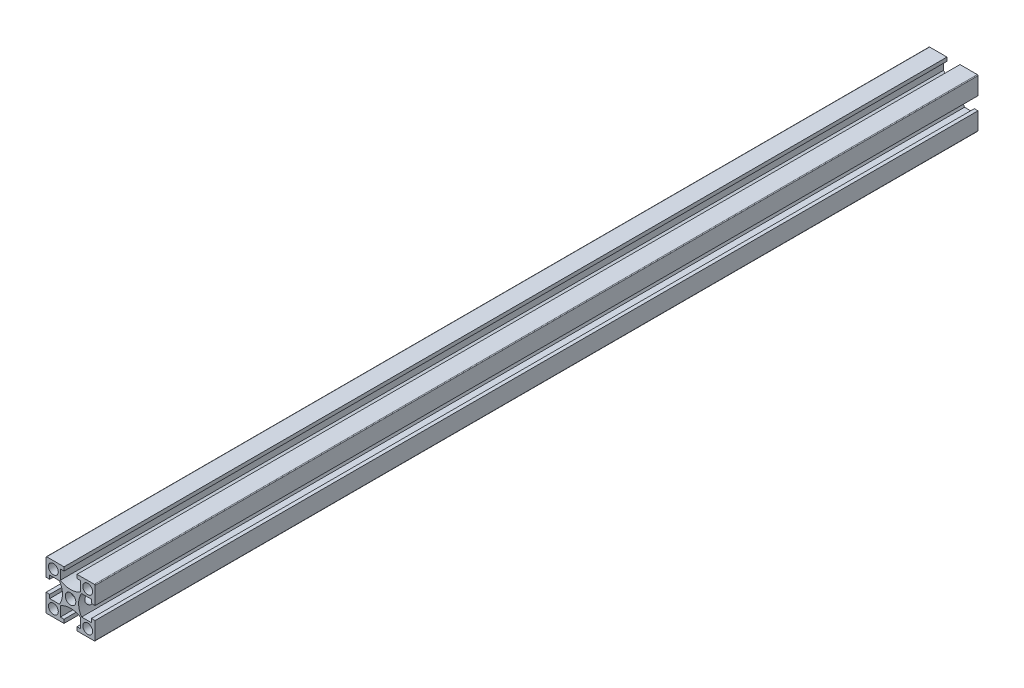
from build123d import *

# Parameters (mm, degrees)
SKETCH_1_W               = 20
SKETCH_1_H               = 20
SKETCH_1_R               = 2
SKETCH_1_R_2             = 2.15
EXTRUDE_1_DEPTH          = 360
CUT_EXTRUDE_1_REACH      = 362.278
PATTERN_CIRCULAR_1_COUNT = 4
FILLET_1_R               = 0.3
CUT_EXTRUDE_2_DEPTH      = 361.277670693
CUT_EXTRUDE_2_DEPTH_BACK = 361.277670693
SKETCH_2_R               = 2.5


with BuildPart() as part:
    # 스케치1 → 보스-돌출1 (new body)
    with BuildSketch(Plane.XY):
        Rectangle(SKETCH_1_W, SKETCH_1_H)
        with Locations((-7, -7)):
            Circle(SKETCH_1_R, mode=Mode.SUBTRACT)
        with Locations((7, -7)):
            Circle(SKETCH_1_R, mode=Mode.SUBTRACT)
        with Locations((-7, 7)):
            Circle(SKETCH_1_R, mode=Mode.SUBTRACT)
        Circle(SKETCH_1_R_2, mode=Mode.SUBTRACT)
        with Locations((7, 7)):
            Circle(SKETCH_1_R, mode=Mode.SUBTRACT)
    extrude(amount=EXTRUDE_1_DEPTH)

    # 스케치1<3> → 컷-돌출1 (cut, up to next)
    with BuildSketch(Plane.XY, mode=Mode.PRIVATE) as cut_extrude_1_sk1:
        with BuildLine():
            Line((-8.5, 2.65), (-10, 2.65))
            Line((-10, 2.65), (-10, -2.65))
            Line((-10, -2.65), (-8.5, -2.65))
            Line((-8.5, -2.65), (-8.5, -4.15))
            Line((-8.5, -4.15), (-4.503166667, -4.15))
            ThreePointArc((-4.503166667, -4.15), (-3.3, 0), (-4.503166667, 4.15))
            Line((-4.503166667, 4.15), (-8.5, 4.15))
            Line((-8.5, 4.15), (-8.5, 2.65))
        make_face()
    cut_extrude_1_tool1 = extrude(cut_extrude_1_sk1.sketch, amount=CUT_EXTRUDE_1_REACH, mode=Mode.PRIVATE) & part.part
    cut_extrude_1 = cut_extrude_1_tool1.solids().sort_by_distance((-6.606913, 0, 0))[0]
    add(cut_extrude_1, mode=Mode.SUBTRACT)

    # 원형 패턴1: 컷-돌출1 ×4 about axis
    pattern_circular_1_axis = Axis((0, 0, 360), (0, 0, -1))
    for i in range(1, PATTERN_CIRCULAR_1_COUNT):
        add(cut_extrude_1.rotate(pattern_circular_1_axis, i * 360 / PATTERN_CIRCULAR_1_COUNT), mode=Mode.SUBTRACT)

    # 필렛1
    fillet_1_edges = [part.edges().sort_by_distance(p)[0] for p in [
        (10, -10, 180),
        (-10, -10, 180),
        (-10, 10, 180),
        (10, 10, 180),
    ]]
    fillet(fillet_1_edges, radius=FILLET_1_R)

    # 스케치2 → 컷-돌출2 (cut, two sides: drawn at the far end of the back side and taken through both)
    with BuildSketch(Plane(origin=(0, 0, 0), x_dir=(0, 0, -1), z_dir=(1, 0, 0)).offset(-CUT_EXTRUDE_2_DEPTH_BACK)):
        with Locations((-5, 0)):
            Circle(SKETCH_2_R)
        with Locations((-355, 0)):
            Circle(SKETCH_2_R)
    extrude(amount=CUT_EXTRUDE_2_DEPTH + CUT_EXTRUDE_2_DEPTH_BACK, mode=Mode.SUBTRACT)


solid = part.part
